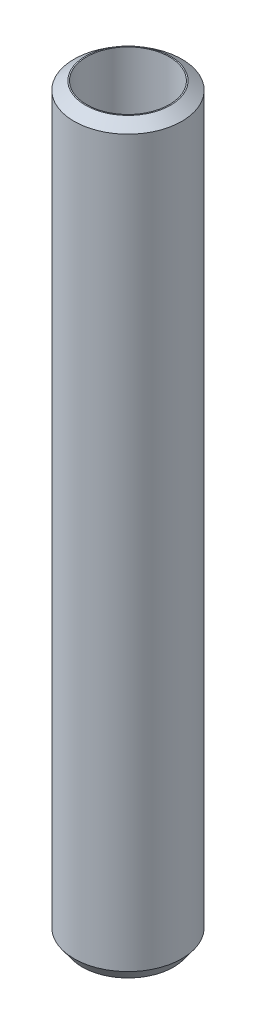
from build123d import *
from OCP.BRepFilletAPI import BRepFilletAPI_MakeChamfer

# Parameters (mm, degrees)
SKETCH1_R           = 22.5
BOSS_EXTRUDE1_DEPTH = 310.932394942
SKETCH2_R           = 17.275306439
CUT_EXTRUDE1_DEPTH  = 313.556321683
CHAMFER1_SIZE       = 3.429884828
CHAMFER1_SIZE2      = 4.743002966


with BuildPart() as part:
    # Sketch1 → Boss-Extrude1 (new body)
    with BuildSketch(Plane(origin=(0, 0, 0), x_dir=(1, 0, 0), z_dir=(0, 1, 0))):
        Circle(SKETCH1_R)
    extrude(amount=BOSS_EXTRUDE1_DEPTH)

    # Sketch2 → Cut-Extrude1 (cut, through all)
    with BuildSketch(Plane(origin=(0, 0, 0), x_dir=(1, 0, 0), z_dir=(0, 1, 0))):
        Circle(SKETCH2_R)
    extrude(amount=CUT_EXTRUDE1_DEPTH, mode=Mode.SUBTRACT)

    # Chamfer1: one chamfer whose edges measure the first distance from different faces: ONE call of the kernel's chamfer builder (chamfer() names one face for all edges)
    chamfer1_edges_1 = [part.edges().sort_by_distance(p)[0] for p in [
        (-22.5, 310.932394942, 0),
    ]]
    chamfer1_side_1 = [part.faces().sort_by_distance(p)[0] for p in [
        (-22.5, 155.466197471, 0),
    ]]
    chamfer1_edges_2 = [part.edges().sort_by_distance(p)[0] for p in [
        (-22.5, 0, 0),
    ]]
    chamfer1_side_2 = [part.faces().sort_by_distance(p)[0] for p in [
        (-21.863603897, 0, 0),
    ]]
    chamfer1 = BRepFilletAPI_MakeChamfer(part.part.solid().wrapped)
    for e in chamfer1_edges_1:
        chamfer1.Add(CHAMFER1_SIZE, CHAMFER1_SIZE2, e.wrapped, chamfer1_side_1[0].wrapped)  # the first distance lies on this face
    for e in chamfer1_edges_2:
        chamfer1.Add(CHAMFER1_SIZE, CHAMFER1_SIZE2, e.wrapped, chamfer1_side_2[0].wrapped)  # the first distance lies on this face
    add(Compound.cast(chamfer1.Shape()), mode=Mode.REPLACE)


solid = part.part
